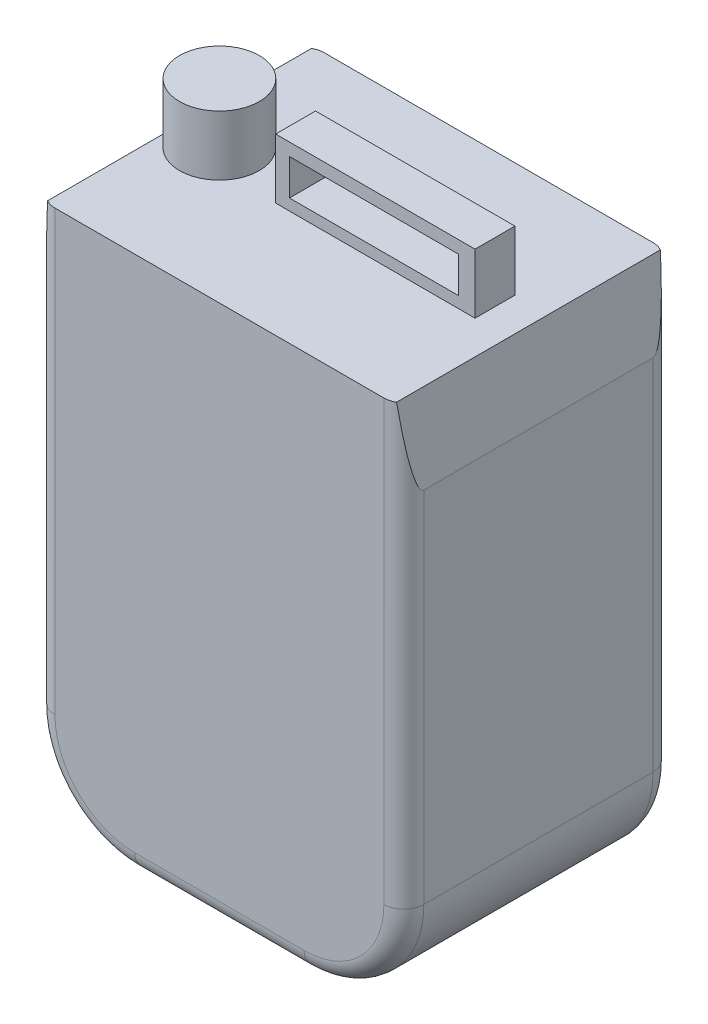
from build123d import *

# Parameters (mm, degrees)
BOSS_EXTRUDE2_DEPTH = 135
SKETCH2_R           = 20
SKETCH2_W           = 100
SKETCH2_H           = 20
BOSS_EXTRUDE3_DEPTH = 30
SKETCH3_W           = 84.902161113
SKETCH3_H           = 18.014954353
CUT_EXTRUDE1_DEPTH  = 30
FILLET1_R           = 10
FILLET2_R           = 10


with BuildPart() as part:
    # Sketch1 → Boss-Extrude2 (new body)
    with BuildSketch(Plane.XY):
        with BuildLine():
            Line((-21.469266172, 234.360279406), (153.530733828, 234.360279406))
            Line((153.530733828, 234.360279406), (158.530733828, 194.360279406))
            Line((158.530733828, 194.360279406), (158.530733828, 14.360279406))
            ThreePointArc((158.530733828, 14.360279406), (143.886072887, -20.995059653), (108.530733828, -35.639720594))
            Line((108.530733828, -35.639720594), (23.530733828, -35.639720594))
            ThreePointArc((23.530733828, -35.639720594), (-11.824605232, -20.995059653), (-26.469266172, 14.360279406))
            Line((-26.469266172, 14.360279406), (-26.469266172, 194.360279406))
            Line((-26.469266172, 194.360279406), (-21.469266172, 234.360279406))
        make_face()
    extrude(amount=BOSS_EXTRUDE2_DEPTH)

    # Sketch2 → Boss-Extrude3 (add)
    with BuildSketch(Plane(origin=(0, 234.360279406, 0), x_dir=(1, 0, 0), z_dir=(0, 1, 0))):
        with Locations(Location((-1.469266172, -67.5, 0), (0, 0, 180))):
            Circle(SKETCH2_R)
        with Locations((86.735726722, -67.5)):
            Rectangle(SKETCH2_W, SKETCH2_H)
    extrude(amount=BOSS_EXTRUDE3_DEPTH)

    # Sketch3 → Cut-Extrude1 (cut)
    with BuildSketch(Plane.XY.offset(77.5)):
        with Locations((86.110215993, 249.037763676)):
            Rectangle(SKETCH3_W, SKETCH3_H)
    extrude(amount=-CUT_EXTRUDE1_DEPTH, mode=Mode.SUBTRACT)

    # Fillet1
    fillet1_edges = [part.edges().sort_by_distance(p)[0] for p in [
        (158.530733828, 104.360279406, 135),
        (143.886072887, -20.995059653, 135),
        (66.030733828, -35.639720594, 135),
        (-11.824605232, -20.995059653, 135),
        (-26.469266172, 104.360279406, 135),
    ]]
    fillet(fillet1_edges, radius=FILLET1_R)

    # Fillet2
    # the kernel refuses this fillet: 10 mm, written as the material it takes off along each edge
    with BuildSketch(Plane(origin=(-26.469266172, 14.360279406, 0), x_dir=(0, 0, 1), z_dir=(0, 1, 0))) as fillet2_piece_1:
        with BuildLine():
            CenterArc((FILLET2_R, FILLET2_R), FILLET2_R, 180, 90)
            Line((0, FILLET2_R), (-FILLET2_R * 0.02, FILLET2_R))
            Line((-FILLET2_R * 0.02, FILLET2_R), (-FILLET2_R * 0.02, -FILLET2_R * 0.02))
            Line((-FILLET2_R * 0.02, -FILLET2_R * 0.02), (FILLET2_R, -FILLET2_R * 0.02))
            Line((FILLET2_R, -FILLET2_R * 0.02), (FILLET2_R, 0))
        make_face()
    extrude(amount=240, mode=Mode.SUBTRACT)
    with BuildSketch(Plane(origin=(23.530733828, 14.360279406, 0), x_dir=(0, -1, 0), z_dir=(1, 0, 0))) as fillet2_piece_2:
        with BuildLine():
            CenterArc((50 - FILLET2_R, -FILLET2_R), FILLET2_R, 0, 90)
            Line((50 - FILLET2_R, 0), (50 - FILLET2_R, FILLET2_R * 0.02))
            Line((50 - FILLET2_R, FILLET2_R * 0.02), (50 + FILLET2_R * 0.02, FILLET2_R * 0.02))
            Line((50 + FILLET2_R * 0.02, FILLET2_R * 0.02), (50 + FILLET2_R * 0.02, -FILLET2_R))
            Line((50 + FILLET2_R * 0.02, -FILLET2_R), (50, -FILLET2_R))
        make_face()
    revolve(axis=Axis((23.530733828, 14.360279406, 0), (0, 0, -1)), revolution_arc=90, mode=Mode.SUBTRACT)
    with BuildSketch(Plane(origin=(108.530733828, -35.639720594, 0), x_dir=(0, 1, 0), z_dir=(-1, 0, 0))) as fillet2_piece_3:
        with BuildLine():
            CenterArc((FILLET2_R, -FILLET2_R), FILLET2_R, 90, 90)
            Line((0, -FILLET2_R), (-FILLET2_R * 0.02, -FILLET2_R))
            Line((-FILLET2_R * 0.02, -FILLET2_R), (-FILLET2_R * 0.02, FILLET2_R * 0.02))
            Line((-FILLET2_R * 0.02, FILLET2_R * 0.02), (FILLET2_R, FILLET2_R * 0.02))
            Line((FILLET2_R, FILLET2_R * 0.02), (FILLET2_R, 0))
        make_face()
    extrude(amount=85, mode=Mode.SUBTRACT)
    with BuildSketch(Plane(origin=(108.530733828, 14.360279406, 0), x_dir=(1, 0, 0), z_dir=(0, 1, 0))) as fillet2_piece_4:
        with BuildLine():
            CenterArc((50 - FILLET2_R, -FILLET2_R), FILLET2_R, 0, 90)
            Line((50, -FILLET2_R), (50 + FILLET2_R * 0.02, -FILLET2_R))
            Line((50 + FILLET2_R * 0.02, -FILLET2_R), (50 + FILLET2_R * 0.02, FILLET2_R * 0.02))
            Line((50 + FILLET2_R * 0.02, FILLET2_R * 0.02), (50 - FILLET2_R, FILLET2_R * 0.02))
            Line((50 - FILLET2_R, FILLET2_R * 0.02), (50 - FILLET2_R, 0))
        make_face()
    revolve(axis=Axis((108.530733828, 14.360279406, 0), (0, 0, -1)), revolution_arc=90, mode=Mode.SUBTRACT)
    with BuildSketch(Plane(origin=(158.530733828, 254.360279406, 0), x_dir=(-1, 0, 0), z_dir=(0, -1, 0))) as fillet2_piece_5:
        with BuildLine():
            CenterArc((FILLET2_R, -FILLET2_R), FILLET2_R, 90, 90)
            Line((0, -FILLET2_R), (-FILLET2_R * 0.02, -FILLET2_R))
            Line((-FILLET2_R * 0.02, -FILLET2_R), (-FILLET2_R * 0.02, FILLET2_R * 0.02))
            Line((-FILLET2_R * 0.02, FILLET2_R * 0.02), (FILLET2_R, FILLET2_R * 0.02))
            Line((FILLET2_R, FILLET2_R * 0.02), (FILLET2_R, 0))
        make_face()
    extrude(amount=240, mode=Mode.SUBTRACT)


solid = part.part
